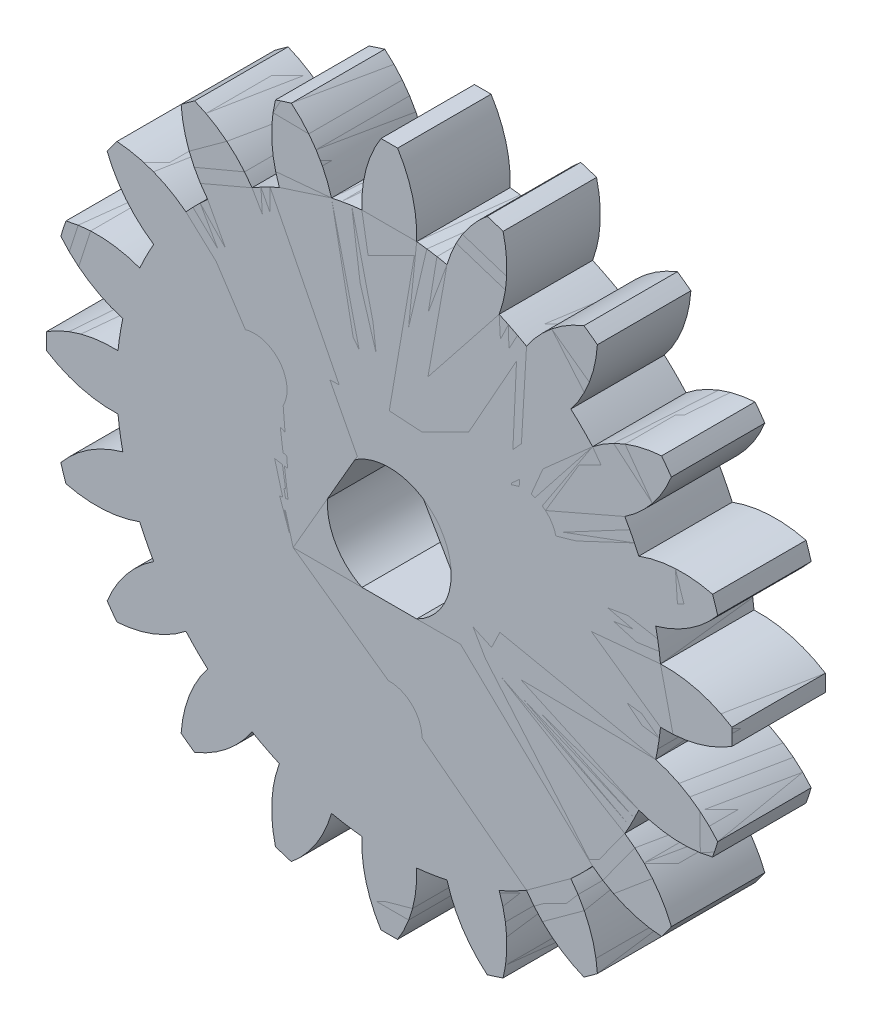
from build123d import *

# Parameters (mm, degrees)
BOSS_EXTRUDE1_OUTLINE_R   = 2
BOSS_EXTRUDE1_DEPTH       = 6
BOSS_EXTRUDE1_2_OUTLINE_R = 3.975
BOSS_EXTRUDE1_2_DEPTH     = 6
BOSS_EXTRUDE2_DEPTH       = 6
SKETCH4_R                 = 2.1
CUT_EXTRUDE2_DEPTH        = 10
CUT_EXTRUDE4_DEPTH        = 10


# Read off the part's stored shape, not the designer's step: Boss-Extrude1
with BuildPart() as part:
    # Boss-Extrude1 outline → Boss-Extrude1 (new body)
    with BuildSketch(Plane.XY):
        with BuildLine():
            ThreePointArc((13.35981926, 17.478993946), (12.93127555, 17.798373876), (12.495099897, 18.107249337))
            ThreePointArc((12.495099897, 18.107249337), (10.42619144, 16.892644253), (8.810439427, 15.119231399))
            ThreePointArc((8.810439427, 15.119231399), (7.944379755, 15.591723167), (7.053068783, 16.014656467))
            ThreePointArc((7.053068783, 16.014656467), (7.538074714, 18.364213226), (7.304636989, 20.751922283))
            ThreePointArc((7.304636989, 20.751922283), (6.798373876, 20.923243358), (6.288098413, 21.082215689))
            ThreePointArc((6.288098413, 21.082215689), (4.695783155, 19.287729736), (3.707126384, 17.101819055))
            ThreePointArc((3.707126384, 17.101819055), (2.737446704, 17.283558272), (1.759066019, 17.410361505))
            ThreePointArc((1.759066019, 17.410361505), (1.494281102, 19.794797846), (0.534425957, 21.993507881))
            ThreePointArc((0.534425957, 21.993507881), (0, 22), (-0.534425957, 21.993507881))
            ThreePointArc((-0.534425957, 21.993507881), (-1.494281102, 19.794797847), (-1.759066019, 17.410361506))
            ThreePointArc((-1.759066019, 17.410361506), (-2.737446704, 17.283558272), (-3.707126384, 17.101819055))
            ThreePointArc((-3.707126384, 17.101819055), (-4.695783155, 19.287729736), (-6.288098413, 21.082215689))
            ThreePointArc((-6.288098413, 21.082215689), (-6.798373877, 20.923243359), (-7.30463699, 20.751922284))
            ThreePointArc((-7.30463699, 20.751922284), (-7.538074714, 18.364213226), (-7.053068783, 16.014656467))
            ThreePointArc((-7.053068783, 16.014656467), (-7.944379755, 15.591723167), (-8.810439427, 15.1192314))
            ThreePointArc((-8.810439427, 15.1192314), (-10.42619144, 16.892644253), (-12.495099898, 18.107249337))
            ThreePointArc((-12.495099898, 18.107249337), (-12.931275551, 17.798373876), (-13.35981926, 17.478993946))
            ThreePointArc((-13.35981926, 17.478993946), (-12.843989052, 15.136011464), (-11.656668033, 13.051325273))
            ThreePointArc((-11.656668033, 13.051325273), (-12.373661564, 12.373661564), (-13.051325273, 11.656668033))
            ThreePointArc((-13.051325273, 11.656668033), (-15.136011464, 12.843989052), (-17.478993946, 13.35981926))
            ThreePointArc((-17.478993946, 13.35981926), (-17.798373876, 12.93127555), (-18.107249337, 12.495099897))
            ThreePointArc((-18.107249337, 12.495099897), (-16.892644253, 10.42619144), (-15.1192314, 8.810439427))
            ThreePointArc((-15.1192314, 8.810439427), (-15.591723167, 7.944379755), (-16.014656467, 7.053068783))
            ThreePointArc((-16.014656467, 7.053068783), (-18.364213225, 7.538074714), (-20.751922283, 7.30463699))
            ThreePointArc((-20.751922283, 7.30463699), (-20.923243359, 6.798373877), (-21.082215689, 6.288098413))
            ThreePointArc((-21.082215689, 6.288098413), (-19.287729736, 4.695783155), (-17.101819055, 3.707126384))
            ThreePointArc((-17.101819055, 3.707126384), (-17.283558272, 2.737446704), (-17.410361505, 1.759066019))
            ThreePointArc((-17.410361505, 1.759066019), (-19.794797846, 1.494281102), (-21.993507881, 0.534425956))
            ThreePointArc((-21.993507881, 0.534425956), (-22, -1e-09), (-21.993507881, -0.534425957))
            ThreePointArc((-21.993507881, -0.534425957), (-19.794797846, -1.494281102), (-17.410361505, -1.759066019))
            ThreePointArc((-17.410361505, -1.759066019), (-17.283558272, -2.737446704), (-17.101819055, -3.707126384))
            ThreePointArc((-17.101819055, -3.707126384), (-19.287729736, -4.695783155), (-21.082215689, -6.288098413))
            ThreePointArc((-21.082215689, -6.288098413), (-20.923243359, -6.798373877), (-20.751922283, -7.30463699))
            ThreePointArc((-20.751922283, -7.30463699), (-18.364213225, -7.538074714), (-16.014656467, -7.053068783))
            ThreePointArc((-16.014656467, -7.053068783), (-15.591723167, -7.944379755), (-15.1192314, -8.810439427))
            ThreePointArc((-15.1192314, -8.810439427), (-16.892644253, -10.42619144), (-18.107249337, -12.495099897))
            ThreePointArc((-18.107249337, -12.495099897), (-17.798373876, -12.93127555), (-17.478993946, -13.35981926))
            ThreePointArc((-17.478993946, -13.35981926), (-15.136011463, -12.843989052), (-13.051325272, -11.656668033))
            ThreePointArc((-13.051325272, -11.656668033), (-12.373661564, -12.373661564), (-11.656668033, -13.051325272))
            ThreePointArc((-11.656668033, -13.051325272), (-12.843989052, -15.136011463), (-13.35981926, -17.478993946))
            ThreePointArc((-13.35981926, -17.478993946), (-12.93127555, -17.798373876), (-12.495099897, -18.107249337))
            ThreePointArc((-12.495099897, -18.107249337), (-10.42619144, -16.892644253), (-8.810439427, -15.119231399))
            ThreePointArc((-8.810439427, -15.119231399), (-7.944379755, -15.591723167), (-7.053068783, -16.014656467))
            ThreePointArc((-7.053068783, -16.014656467), (-7.538074714, -18.364213226), (-7.304636989, -20.751922283))
            ThreePointArc((-7.304636989, -20.751922283), (-6.798373876, -20.923243358), (-6.288098413, -21.082215689))
            ThreePointArc((-6.288098413, -21.082215689), (-4.695783155, -19.287729736), (-3.707126384, -17.101819055))
            ThreePointArc((-3.707126384, -17.101819055), (-2.737446704, -17.283558272), (-1.759066019, -17.410361505))
            ThreePointArc((-1.759066019, -17.410361505), (-1.494281102, -19.794797846), (-0.534425956, -21.993507881))
            ThreePointArc((-0.534425956, -21.993507881), (1e-09, -22), (0.534425957, -21.993507881))
            ThreePointArc((0.534425957, -21.993507881), (1.494281102, -19.794797846), (1.759066019, -17.410361505))
            ThreePointArc((1.759066019, -17.410361505), (2.737446704, -17.283558272), (3.707126384, -17.101819055))
            ThreePointArc((3.707126384, -17.101819055), (4.695783155, -19.287729736), (6.288098413, -21.082215689))
            ThreePointArc((6.288098413, -21.082215689), (6.798373876, -20.923243358), (7.304636989, -20.751922283))
            ThreePointArc((7.304636989, -20.751922283), (7.538074714, -18.364213226), (7.053068783, -16.014656467))
            ThreePointArc((7.053068783, -16.014656467), (7.944379755, -15.591723167), (8.810439427, -15.119231399))
            ThreePointArc((8.810439427, -15.119231399), (10.42619144, -16.892644253), (12.495099897, -18.107249337))
            ThreePointArc((12.495099897, -18.107249337), (12.93127555, -17.798373876), (13.359819259, -17.478993946))
            ThreePointArc((13.359819259, -17.478993946), (12.843989052, -15.136011463), (11.656668033, -13.051325272))
            ThreePointArc((11.656668033, -13.051325272), (12.373661564, -12.373661564), (13.051325272, -11.656668033))
            ThreePointArc((13.051325272, -11.656668033), (15.136011463, -12.843989052), (17.478993946, -13.35981926))
            ThreePointArc((17.478993946, -13.35981926), (17.798373876, -12.93127555), (18.107249337, -12.495099897))
            ThreePointArc((18.107249337, -12.495099897), (16.892644253, -10.42619144), (15.119231399, -8.810439427))
            ThreePointArc((15.119231399, -8.810439427), (15.591723167, -7.944379755), (16.014656467, -7.053068783))
            ThreePointArc((16.014656467, -7.053068783), (18.364213226, -7.538074714), (20.751922283, -7.304636989))
            ThreePointArc((20.751922283, -7.304636989), (20.923243358, -6.798373876), (21.082215689, -6.288098413))
            ThreePointArc((21.082215689, -6.288098413), (19.287729736, -4.695783155), (17.101819055, -3.707126384))
            ThreePointArc((17.101819055, -3.707126384), (17.283558272, -2.737446704), (17.410361505, -1.759066019))
            ThreePointArc((17.410361505, -1.759066019), (19.794797846, -1.494281102), (21.993507881, -0.534425956))
            ThreePointArc((21.993507881, -0.534425956), (22, 1e-09), (21.993507881, 0.534425957))
            ThreePointArc((21.993507881, 0.534425957), (19.794797846, 1.494281102), (17.410361505, 1.759066019))
            ThreePointArc((17.410361505, 1.759066019), (17.283558272, 2.737446704), (17.101819055, 3.707126384))
            ThreePointArc((17.101819055, 3.707126384), (19.287729736, 4.695783155), (21.082215689, 6.288098413))
            ThreePointArc((21.082215689, 6.288098413), (20.923243358, 6.798373876), (20.751922283, 7.304636989))
            ThreePointArc((20.751922283, 7.304636989), (18.364213226, 7.538074714), (16.014656467, 7.053068783))
            ThreePointArc((16.014656467, 7.053068783), (15.591723167, 7.944379755), (15.119231399, 8.810439427))
            ThreePointArc((15.119231399, 8.810439427), (16.892644253, 10.42619144), (18.107249337, 12.495099897))
            ThreePointArc((18.107249337, 12.495099897), (17.798373876, 12.93127555), (17.478993946, 13.359819259))
            ThreePointArc((17.478993946, 13.359819259), (15.136011463, 12.843989052), (13.051325272, 11.656668033))
            ThreePointArc((13.051325272, 11.656668033), (12.373661564, 12.373661564), (11.656668033, 13.051325272))
            ThreePointArc((11.656668033, 13.051325272), (12.843989052, 15.136011463), (13.35981926, 17.478993946))
        make_face()
        Circle(BOSS_EXTRUDE1_OUTLINE_R, mode=Mode.SUBTRACT)
    extrude(amount=BOSS_EXTRUDE1_DEPTH)

    # Sketch2 → Boss-Extrude2 (add)
    with BuildSketch(Plane.XY.offset(6)):
        Polygon((0, 7.125), (6.170431002, -3.5625), (-6.170431002, -3.5625), align=None)
    extrude(amount=-BOSS_EXTRUDE2_DEPTH)

    # Sketch4 → Cut-Extrude2 (cut)
    with BuildSketch(Plane.XY):
        with Locations((8.660254038, 5)):
            Circle(SKETCH4_R)
        with Locations((0, -10)):
            Circle(SKETCH4_R)
        with Locations((-8.660254038, 5)):
            Circle(SKETCH4_R)
    extrude(amount=CUT_EXTRUDE2_DEPTH, mode=Mode.SUBTRACT)

    # Sketch2<3> → Cut-Extrude4 (cut)
    with BuildSketch(Plane.XY.offset(6)):
        Polygon((0, 7.125), (6.170431002, -3.5625), (-6.170431002, -3.5625), align=None)
    extrude(amount=-CUT_EXTRUDE4_DEPTH, mode=Mode.SUBTRACT)


with BuildPart() as body_2:
    # Boss-Extrude1 2 outline → Boss-Extrude1 2 (new body)
    with BuildSketch(Plane.XY):
        with BuildLine():
            ThreePointArc((13.35981926, 17.478993946), (12.93127555, 17.798373876), (12.495099897, 18.107249337))
            ThreePointArc((12.495099897, 18.107249337), (10.42619144, 16.892644253), (8.810439427, 15.119231399))
            ThreePointArc((8.810439427, 15.119231399), (7.944379755, 15.591723167), (7.053068783, 16.014656467))
            ThreePointArc((7.053068783, 16.014656467), (7.538074714, 18.364213226), (7.304636989, 20.751922283))
            ThreePointArc((7.304636989, 20.751922283), (6.798373876, 20.923243358), (6.288098413, 21.082215689))
            ThreePointArc((6.288098413, 21.082215689), (4.695783155, 19.287729736), (3.707126384, 17.101819055))
            ThreePointArc((3.707126384, 17.101819055), (2.737446704, 17.283558272), (1.759066019, 17.410361505))
            ThreePointArc((1.759066019, 17.410361505), (1.494281102, 19.794797846), (0.534425957, 21.993507881))
            ThreePointArc((0.534425957, 21.993507881), (0, 22), (-0.534425957, 21.993507881))
            ThreePointArc((-0.534425957, 21.993507881), (-1.494281102, 19.794797847), (-1.759066019, 17.410361506))
            ThreePointArc((-1.759066019, 17.410361506), (-2.737446704, 17.283558272), (-3.707126384, 17.101819055))
            ThreePointArc((-3.707126384, 17.101819055), (-4.695783155, 19.287729736), (-6.288098413, 21.082215689))
            ThreePointArc((-6.288098413, 21.082215689), (-6.798373877, 20.923243359), (-7.30463699, 20.751922284))
            ThreePointArc((-7.30463699, 20.751922284), (-7.538074714, 18.364213226), (-7.053068783, 16.014656467))
            ThreePointArc((-7.053068783, 16.014656467), (-7.944379755, 15.591723167), (-8.810439427, 15.1192314))
            ThreePointArc((-8.810439427, 15.1192314), (-10.42619144, 16.892644253), (-12.495099898, 18.107249337))
            ThreePointArc((-12.495099898, 18.107249337), (-12.931275551, 17.798373876), (-13.35981926, 17.478993946))
            ThreePointArc((-13.35981926, 17.478993946), (-12.843989052, 15.136011464), (-11.656668033, 13.051325273))
            ThreePointArc((-11.656668033, 13.051325273), (-12.373661564, 12.373661564), (-13.051325273, 11.656668033))
            ThreePointArc((-13.051325273, 11.656668033), (-15.136011464, 12.843989052), (-17.478993946, 13.35981926))
            ThreePointArc((-17.478993946, 13.35981926), (-17.798373876, 12.93127555), (-18.107249337, 12.495099897))
            ThreePointArc((-18.107249337, 12.495099897), (-16.892644253, 10.42619144), (-15.1192314, 8.810439427))
            ThreePointArc((-15.1192314, 8.810439427), (-15.591723167, 7.944379755), (-16.014656467, 7.053068783))
            ThreePointArc((-16.014656467, 7.053068783), (-18.364213225, 7.538074714), (-20.751922283, 7.30463699))
            ThreePointArc((-20.751922283, 7.30463699), (-20.923243359, 6.798373877), (-21.082215689, 6.288098413))
            ThreePointArc((-21.082215689, 6.288098413), (-19.287729736, 4.695783155), (-17.101819055, 3.707126384))
            ThreePointArc((-17.101819055, 3.707126384), (-17.283558272, 2.737446704), (-17.410361505, 1.759066019))
            ThreePointArc((-17.410361505, 1.759066019), (-19.794797846, 1.494281102), (-21.993507881, 0.534425956))
            ThreePointArc((-21.993507881, 0.534425956), (-22, -1e-09), (-21.993507881, -0.534425957))
            ThreePointArc((-21.993507881, -0.534425957), (-19.794797846, -1.494281102), (-17.410361505, -1.759066019))
            ThreePointArc((-17.410361505, -1.759066019), (-17.283558272, -2.737446704), (-17.101819055, -3.707126384))
            ThreePointArc((-17.101819055, -3.707126384), (-19.287729736, -4.695783155), (-21.082215689, -6.288098413))
            ThreePointArc((-21.082215689, -6.288098413), (-20.923243359, -6.798373877), (-20.751922283, -7.30463699))
            ThreePointArc((-20.751922283, -7.30463699), (-18.364213225, -7.538074714), (-16.014656467, -7.053068783))
            ThreePointArc((-16.014656467, -7.053068783), (-15.591723167, -7.944379755), (-15.1192314, -8.810439427))
            ThreePointArc((-15.1192314, -8.810439427), (-16.892644253, -10.42619144), (-18.107249337, -12.495099897))
            ThreePointArc((-18.107249337, -12.495099897), (-17.798373876, -12.93127555), (-17.478993946, -13.35981926))
            ThreePointArc((-17.478993946, -13.35981926), (-15.136011463, -12.843989052), (-13.051325272, -11.656668033))
            ThreePointArc((-13.051325272, -11.656668033), (-12.373661564, -12.373661564), (-11.656668033, -13.051325272))
            ThreePointArc((-11.656668033, -13.051325272), (-12.843989052, -15.136011463), (-13.35981926, -17.478993946))
            ThreePointArc((-13.35981926, -17.478993946), (-12.93127555, -17.798373876), (-12.495099897, -18.107249337))
            ThreePointArc((-12.495099897, -18.107249337), (-10.42619144, -16.892644253), (-8.810439427, -15.119231399))
            ThreePointArc((-8.810439427, -15.119231399), (-7.944379755, -15.591723167), (-7.053068783, -16.014656467))
            ThreePointArc((-7.053068783, -16.014656467), (-7.538074714, -18.364213226), (-7.304636989, -20.751922283))
            ThreePointArc((-7.304636989, -20.751922283), (-6.798373876, -20.923243358), (-6.288098413, -21.082215689))
            ThreePointArc((-6.288098413, -21.082215689), (-4.695783155, -19.287729736), (-3.707126384, -17.101819055))
            ThreePointArc((-3.707126384, -17.101819055), (-2.737446704, -17.283558272), (-1.759066019, -17.410361505))
            ThreePointArc((-1.759066019, -17.410361505), (-1.494281102, -19.794797846), (-0.534425956, -21.993507881))
            ThreePointArc((-0.534425956, -21.993507881), (1e-09, -22), (0.534425957, -21.993507881))
            ThreePointArc((0.534425957, -21.993507881), (1.494281102, -19.794797846), (1.759066019, -17.410361505))
            ThreePointArc((1.759066019, -17.410361505), (2.737446704, -17.283558272), (3.707126384, -17.101819055))
            ThreePointArc((3.707126384, -17.101819055), (4.695783155, -19.287729736), (6.288098413, -21.082215689))
            ThreePointArc((6.288098413, -21.082215689), (6.798373876, -20.923243358), (7.304636989, -20.751922283))
            ThreePointArc((7.304636989, -20.751922283), (7.538074714, -18.364213226), (7.053068783, -16.014656467))
            ThreePointArc((7.053068783, -16.014656467), (7.944379755, -15.591723167), (8.810439427, -15.119231399))
            ThreePointArc((8.810439427, -15.119231399), (10.42619144, -16.892644253), (12.495099897, -18.107249337))
            ThreePointArc((12.495099897, -18.107249337), (12.93127555, -17.798373876), (13.359819259, -17.478993946))
            ThreePointArc((13.359819259, -17.478993946), (12.843989052, -15.136011463), (11.656668033, -13.051325272))
            ThreePointArc((11.656668033, -13.051325272), (12.373661564, -12.373661564), (13.051325272, -11.656668033))
            ThreePointArc((13.051325272, -11.656668033), (15.136011463, -12.843989052), (17.478993946, -13.35981926))
            ThreePointArc((17.478993946, -13.35981926), (17.798373876, -12.93127555), (18.107249337, -12.495099897))
            ThreePointArc((18.107249337, -12.495099897), (16.892644253, -10.42619144), (15.119231399, -8.810439427))
            ThreePointArc((15.119231399, -8.810439427), (15.591723167, -7.944379755), (16.014656467, -7.053068783))
            ThreePointArc((16.014656467, -7.053068783), (18.364213226, -7.538074714), (20.751922283, -7.304636989))
            ThreePointArc((20.751922283, -7.304636989), (20.923243358, -6.798373876), (21.082215689, -6.288098413))
            ThreePointArc((21.082215689, -6.288098413), (19.287729736, -4.695783155), (17.101819055, -3.707126384))
            ThreePointArc((17.101819055, -3.707126384), (17.283558272, -2.737446704), (17.410361505, -1.759066019))
            ThreePointArc((17.410361505, -1.759066019), (19.794797846, -1.494281102), (21.993507881, -0.534425956))
            ThreePointArc((21.993507881, -0.534425956), (22, 1e-09), (21.993507881, 0.534425957))
            ThreePointArc((21.993507881, 0.534425957), (19.794797846, 1.494281102), (17.410361505, 1.759066019))
            ThreePointArc((17.410361505, 1.759066019), (17.283558272, 2.737446704), (17.101819055, 3.707126384))
            ThreePointArc((17.101819055, 3.707126384), (19.287729736, 4.695783155), (21.082215689, 6.288098413))
            ThreePointArc((21.082215689, 6.288098413), (20.923243358, 6.798373876), (20.751922283, 7.304636989))
            ThreePointArc((20.751922283, 7.304636989), (18.364213226, 7.538074714), (16.014656467, 7.053068783))
            ThreePointArc((16.014656467, 7.053068783), (15.591723167, 7.944379755), (15.119231399, 8.810439427))
            ThreePointArc((15.119231399, 8.810439427), (16.892644253, 10.42619144), (18.107249337, 12.495099897))
            ThreePointArc((18.107249337, 12.495099897), (17.798373876, 12.93127555), (17.478993946, 13.359819259))
            ThreePointArc((17.478993946, 13.359819259), (15.136011463, 12.843989052), (13.051325272, 11.656668033))
            ThreePointArc((13.051325272, 11.656668033), (12.373661564, 12.373661564), (11.656668033, 13.051325272))
            ThreePointArc((11.656668033, 13.051325272), (12.843989052, 15.136011463), (13.35981926, 17.478993946))
        make_face()
        Circle(BOSS_EXTRUDE1_2_OUTLINE_R, mode=Mode.SUBTRACT)
    extrude(amount=BOSS_EXTRUDE1_2_DEPTH)


solid = Compound([part.part, body_2.part])
